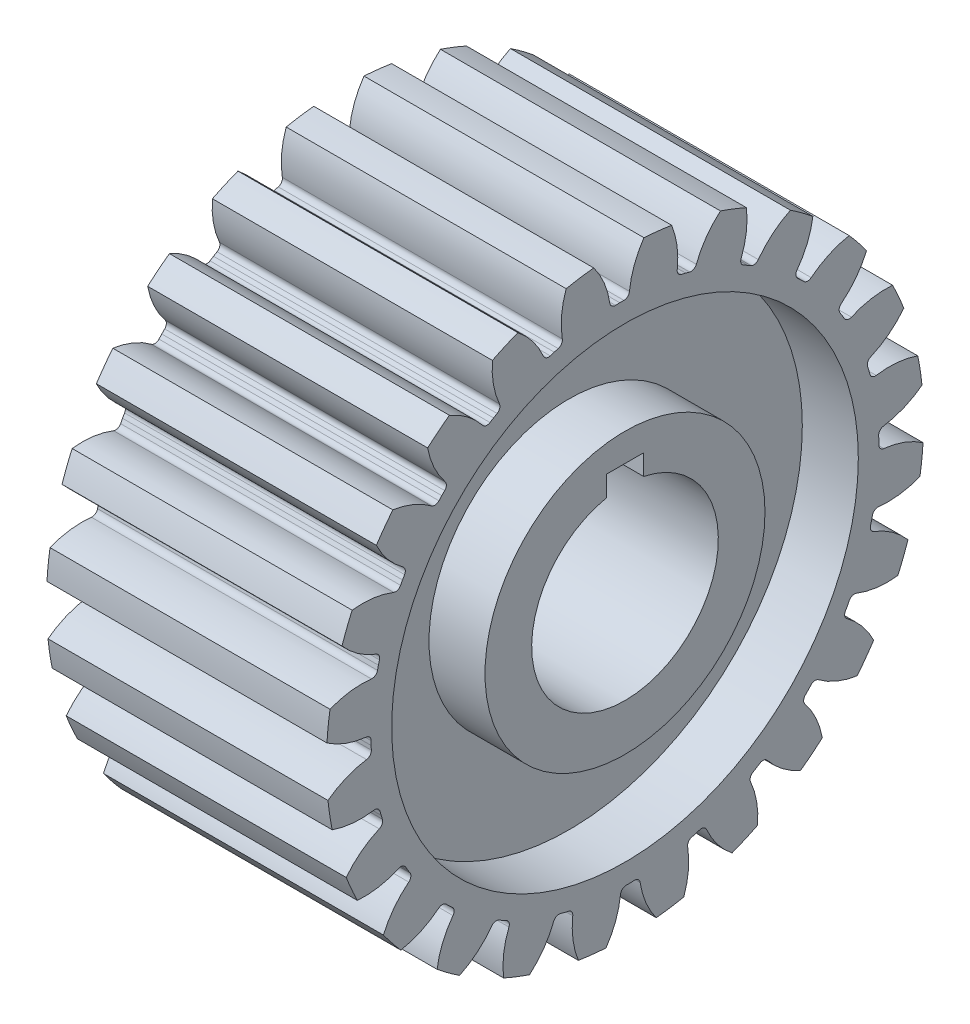
from build123d import *

# Parameters (mm, degrees)
SKETCH1_R           = 16
BOSS_EXTRUDE1_DEPTH = 7.5
CUT_EXTRUDE1_DEPTH  = 28.147743921
SKETCH3_R           = 12.5
SKETCH3_R_2         = 7.5
CUT_EXTRUDE3_DEPTH  = 3
CUT_EXTRUDE4_DEPTH  = 28.147743921
CIRPATTERN1_START   = -7.5
CIRPATTERN1_DEPTH   = 15


# Read off the part's stored shape, not the designer's step: CirPattern1
with BuildPart() as part:
    # Sketch1 → Boss-Extrude1 (new, symmetric)
    with BuildSketch(Plane(origin=(0, 0, 0), x_dir=(0, 0, -1), z_dir=(1, 0, 0))):
        Circle(SKETCH1_R)
    extrude(amount=BOSS_EXTRUDE1_DEPTH, both=True)

    # Sketch2 → Cut-Extrude1 (cut, through all)
    with BuildSketch(Plane(origin=(7.5, 0, 0), x_dir=(0, 0, -1), z_dir=(1, 0, 0))):
        with BuildLine():
            Line((-1, 6), (1, 6))
            Line((1, 6), (1, 4.898979486))
            ThreePointArc((1, 4.898979486), (0, -5), (-1, 4.898979486))
            Line((-1, 4.898979486), (-1, 6))
        make_face()
    extrude(amount=-CUT_EXTRUDE1_DEPTH, mode=Mode.SUBTRACT)

    # Sketch3 → Cut-Extrude3 (cut)
    with BuildSketch(Plane(origin=(7.5, 0, 0), x_dir=(0, 0, -1), z_dir=(1, 0, 0))):
        Circle(SKETCH3_R)
        Circle(SKETCH3_R_2, mode=Mode.SUBTRACT)
    cut_extrude3 = extrude(amount=-CUT_EXTRUDE3_DEPTH, mode=Mode.SUBTRACT)

    # Mirror1: Cut-Extrude3 across plane
    add(cut_extrude3.mirror(Plane(origin=(0, 0, 0), x_dir=(0, 0, 1), z_dir=(1, 0, 0))), mode=Mode.SUBTRACT)

    # Sketch4 → Cut-Extrude4 (cut, through all)
    with BuildSketch(Plane(origin=(7.5, 0, 0), x_dir=(0, 0, -1), z_dir=(1, 0, 0))):
        with BuildLine():
            Line((-0.281405801, 13.6), (-0.059056518, 13.6))
            ThreePointArc((-0.059056518, 13.6), (0.141499156, 13.676891458), (0.239248043, 13.868150522))
            ThreePointArc((0.239248043, 13.868150522), (0.735573834, 15.502749178), (1.798594199, 16.84))
            ThreePointArc((1.798594199, 16.84), (-0.35018508, 16.924018907), (-2.493649696, 16.751186593))
            ThreePointArc((-2.493649696, 16.751186593), (-1.376223147, 15.459052713), (-0.812706186, 13.846383903))
            ThreePointArc((-0.812706186, 13.846383903), (-0.707129438, 13.659331972), (-0.50356477, 13.590802412))
            Line((-0.50356477, 13.590802412), (-0.281405801, 13.6))
        make_face()
    extrude(amount=-CUT_EXTRUDE4_DEPTH, mode=Mode.SUBTRACT)

    # CirPattern1 outline → CirPattern1 (cut)
    with BuildSketch(Plane.YZ.offset(CIRPATTERN1_START)):
        with BuildLine():
            ThreePointArc((15.686592918, 3.151317601), (15.365838094, 4.459934939), (14.936120091, 5.736925712))
            ThreePointArc((14.936120091, 5.736925712), (14.135444289, 4.942400192), (13.164235974, 4.368721754))
            ThreePointArc((13.164235974, 4.368721754), (13.010882955, 4.218329845), (12.997374896, 4.003964719))
            Line((12.997374896, 4.003964719), (13.063758057, 3.791756144))
            Line((13.063758057, 3.791756144), (13.121306286, 3.576983229))
            ThreePointArc((13.121306286, 3.576983229), (13.247485359, 3.403162298), (13.457526702, 3.358245612))
            ThreePointArc((13.457526702, 3.358245612), (14.584955531, 3.393696665), (15.686592918, 3.151317601))
        make_face()
        with BuildLine():
            ThreePointArc((14.336464214, 7.103928057), (13.687943756, 8.284937884), (12.942358506, 9.407197048))
            ThreePointArc((12.942358506, 9.407197048), (12.374603407, 8.432514182), (11.584967118, 7.627016154))
            ThreePointArc((11.584967118, 7.627016154), (11.475763767, 7.442058043), (11.518197761, 7.231501089))
            Line((11.518197761, 7.231501089), (11.637242591, 7.043704572))
            Line((11.637242591, 7.043704572), (11.748417233, 6.851144445))
            ThreePointArc((11.748417233, 6.851144445), (11.915285025, 6.715903865), (12.129794677, 6.726880378))
            ThreePointArc((12.129794677, 6.726880378), (13.209631893, 7.052923519), (14.336464214, 7.103928057))
        make_face()
        with BuildLine():
            ThreePointArc((12.009329166, 10.572417557), (11.077238671, 11.545336004), (10.066596577, 12.436383452))
            ThreePointArc((10.066596577, 12.436383452), (9.770453752, 11.347966267), (9.216201898, 10.365542008))
            ThreePointArc((9.216201898, 10.365542008), (9.158590243, 10.158622285), (9.254074483, 9.966222611))
            Line((9.254074483, 9.966222611), (9.417668274, 9.815636174))
            Line((9.417668274, 9.815636174), (9.57489296, 9.658411488))
            ThreePointArc((9.57489296, 9.658411488), (9.771077708, 9.570967683), (9.97543719, 9.637089363))
            ThreePointArc((9.97543719, 9.637089363), (10.934093671, 10.23150529), (12.009329166, 10.572417557))
        make_face()
        with BuildLine():
            ThreePointArc((8.863778181, 13.320414272), (7.711638076, 14.018938555), (6.504812727, 14.618050876))
            ThreePointArc((6.504812727, 14.618050876), (6.500463821, 13.490073203), (6.219367749, 12.397673303))
            ThreePointArc((6.219367749, 12.397673303), (6.217273929, 12.182893206), (6.359301322, 12.021762532))
            Line((6.359301322, 12.021762532), (6.556295428, 11.918648392))
            Line((6.556295428, 11.918648392), (6.748855555, 11.80747375))
            ThreePointArc((6.748855555, 11.80747375), (6.960987592, 11.773785869), (7.141270144, 11.890546634))
            ThreePointArc((7.141270144, 11.890546634), (7.913415034, 12.712826885), (8.863778181, 13.320414272))
        make_face()
        with BuildLine():
            ThreePointArc((5.114175361, 15.160646767), (3.82050209, 15.537173611), (2.499736639, 15.80352229))
            ThreePointArc((2.499736639, 15.80352229), (2.787478023, 14.712853944), (2.798693966, 13.584923651))
            ThreePointArc((2.798693966, 13.584923651), (2.852260671, 13.376920087), (3.031152285, 13.258039202))
            Line((3.031152285, 13.258039202), (3.248121883, 13.209424418))
            Line((3.248121883, 13.209424418), (3.462894798, 13.151876189))
            ThreePointArc((3.462894798, 13.151876189), (3.676517676, 13.174240006), (3.820437339, 13.333682802))
            ThreePointArc((3.820437339, 13.333682802), (4.353450241, 14.327790336), (5.114175361, 15.160646767))
        make_face()
        with BuildLine():
            ThreePointArc((1.016049943, 15.967706239), (-0.330994798, 15.996575961), (-1.675692369, 15.912009776))
            ThreePointArc((-1.675692369, 15.912009776), (-1.115469796, 14.932978003), (-0.812706186, 13.846383903))
            ThreePointArc((-0.812706186, 13.846383903), (-0.707129438, 13.659331972), (-0.50356477, 13.590802412))
            Line((-0.50356477, 13.590802412), (-0.281405801, 13.6))
            Line((-0.281405801, 13.6), (-0.059056518, 13.6))
            ThreePointArc((-0.059056518, 13.6), (0.141499156, 13.676891458), (0.239248043, 13.868150522))
            ThreePointArc((0.239248043, 13.868150522), (0.496805008, 14.966338553), (1.016049943, 15.967706239))
        make_face()
        with BuildLine():
            ThreePointArc((-3.151317601, 15.686592919), (-4.45993494, 15.365838095), (-5.736925712, 14.936120092))
            ThreePointArc((-5.736925712, 14.936120092), (-4.942400192, 14.135444289), (-4.368721754, 13.164235974))
            ThreePointArc((-4.368721754, 13.164235974), (-4.218329845, 13.010882955), (-4.003964719, 12.997374896))
            Line((-4.003964719, 12.997374896), (-3.791756144, 13.063758057))
            Line((-3.791756144, 13.063758057), (-3.576983229, 13.121306286))
            ThreePointArc((-3.576983229, 13.121306286), (-3.403162298, 13.247485359), (-3.358245612, 13.457526702))
            ThreePointArc((-3.358245612, 13.457526702), (-3.393696665, 14.584955531), (-3.151317601, 15.686592919))
        make_face()
        with BuildLine():
            ThreePointArc((-7.103928057, 14.336464215), (-8.284937884, 13.687943756), (-9.407197049, 12.942358507))
            ThreePointArc((-9.407197049, 12.942358507), (-8.432514182, 12.374603407), (-7.627016154, 11.584967118))
            ThreePointArc((-7.627016154, 11.584967118), (-7.442058043, 11.475763767), (-7.231501089, 11.518197761))
            Line((-7.231501089, 11.518197761), (-7.043704572, 11.637242591))
            Line((-7.043704572, 11.637242591), (-6.851144445, 11.748417233))
            ThreePointArc((-6.851144445, 11.748417233), (-6.715903865, 11.915285025), (-6.726880378, 12.129794677))
            ThreePointArc((-6.726880378, 12.129794677), (-7.052923519, 13.209631893), (-7.103928057, 14.336464215))
        make_face()
        with BuildLine():
            ThreePointArc((-10.572417557, 12.009329166), (-11.545336004, 11.077238671), (-12.436383452, 10.066596577))
            ThreePointArc((-12.436383452, 10.066596577), (-11.347966267, 9.770453752), (-10.365542008, 9.216201898))
            ThreePointArc((-10.365542008, 9.216201898), (-10.158622285, 9.158590243), (-9.966222611, 9.254074483))
            Line((-9.966222611, 9.254074483), (-9.815636174, 9.417668274))
            Line((-9.815636174, 9.417668274), (-9.658411488, 9.57489296))
            ThreePointArc((-9.658411488, 9.57489296), (-9.570967683, 9.771077708), (-9.637089363, 9.97543719))
            ThreePointArc((-9.637089363, 9.97543719), (-10.23150529, 10.934093671), (-10.572417557, 12.009329166))
        make_face()
        with BuildLine():
            ThreePointArc((-13.320414272, 8.863778181), (-14.018938555, 7.711638076), (-14.618050875, 6.504812727))
            ThreePointArc((-14.618050875, 6.504812727), (-13.490073203, 6.500463821), (-12.397673303, 6.219367749))
            ThreePointArc((-12.397673303, 6.219367749), (-12.182893206, 6.217273929), (-12.021762532, 6.359301322))
            Line((-12.021762532, 6.359301322), (-11.918648392, 6.556295428))
            Line((-11.918648392, 6.556295428), (-11.80747375, 6.748855555))
            ThreePointArc((-11.80747375, 6.748855555), (-11.773785869, 6.960987592), (-11.890546634, 7.141270144))
            ThreePointArc((-11.890546634, 7.141270144), (-12.712826885, 7.913415034), (-13.320414272, 8.863778181))
        make_face()
        with BuildLine():
            ThreePointArc((-15.160646767, 5.114175361), (-15.53717361, 3.82050209), (-15.803522289, 2.499736639))
            ThreePointArc((-15.803522289, 2.499736639), (-14.712853944, 2.787478023), (-13.584923651, 2.798693966))
            ThreePointArc((-13.584923651, 2.798693966), (-13.376920087, 2.852260671), (-13.258039202, 3.031152285))
            Line((-13.258039202, 3.031152285), (-13.209424418, 3.248121883))
            Line((-13.209424418, 3.248121883), (-13.151876189, 3.462894798))
            ThreePointArc((-13.151876189, 3.462894798), (-13.174240006, 3.676517676), (-13.333682802, 3.820437339))
            ThreePointArc((-13.333682802, 3.820437339), (-14.327790336, 4.353450241), (-15.160646767, 5.114175361))
        make_face()
        with BuildLine():
            ThreePointArc((-15.967706238, 1.016049943), (-15.99657596, -0.330994798), (-15.912009775, -1.675692369))
            ThreePointArc((-15.912009775, -1.675692369), (-14.932978003, -1.115469796), (-13.846383903, -0.812706186))
            ThreePointArc((-13.846383903, -0.812706186), (-13.659331972, -0.707129438), (-13.590802412, -0.50356477))
            Line((-13.590802412, -0.50356477), (-13.6, -0.281405801))
            Line((-13.6, -0.281405801), (-13.6, -0.059056518))
            ThreePointArc((-13.6, -0.059056518), (-13.676891458, 0.141499156), (-13.868150522, 0.239248043))
            ThreePointArc((-13.868150522, 0.239248043), (-14.966338553, 0.496805008), (-15.967706238, 1.016049943))
        make_face()
        with BuildLine():
            ThreePointArc((-15.686592918, -3.151317601), (-15.365838094, -4.459934939), (-14.936120091, -5.736925712))
            ThreePointArc((-14.936120091, -5.736925712), (-14.135444289, -4.942400192), (-13.164235974, -4.368721754))
            ThreePointArc((-13.164235974, -4.368721754), (-13.010882955, -4.218329845), (-12.997374896, -4.003964719))
            Line((-12.997374896, -4.003964719), (-13.063758057, -3.791756144))
            Line((-13.063758057, -3.791756144), (-13.121306286, -3.576983229))
            ThreePointArc((-13.121306286, -3.576983229), (-13.247485359, -3.403162298), (-13.457526702, -3.358245612))
            ThreePointArc((-13.457526702, -3.358245612), (-14.584955531, -3.393696665), (-15.686592918, -3.151317601))
        make_face()
        with BuildLine():
            ThreePointArc((-14.336464214, -7.103928057), (-13.687943755, -8.284937884), (-12.942358506, -9.407197048))
            ThreePointArc((-12.942358506, -9.407197048), (-12.374603407, -8.432514182), (-11.584967118, -7.627016154))
            ThreePointArc((-11.584967118, -7.627016154), (-11.475763767, -7.442058043), (-11.518197761, -7.231501089))
            Line((-11.518197761, -7.231501089), (-11.637242591, -7.043704572))
            Line((-11.637242591, -7.043704572), (-11.748417233, -6.851144445))
            ThreePointArc((-11.748417233, -6.851144445), (-11.915285025, -6.715903865), (-12.129794677, -6.726880378))
            ThreePointArc((-12.129794677, -6.726880378), (-13.209631893, -7.052923519), (-14.336464214, -7.103928057))
        make_face()
        with BuildLine():
            ThreePointArc((-12.009329165, -10.572417556), (-11.07723867, -11.545336003), (-10.066596576, -12.436383451))
            ThreePointArc((-10.066596576, -12.436383451), (-9.770453752, -11.347966267), (-9.216201898, -10.365542008))
            ThreePointArc((-9.216201898, -10.365542008), (-9.158590243, -10.158622285), (-9.254074483, -9.966222611))
            Line((-9.254074483, -9.966222611), (-9.417668274, -9.815636174))
            Line((-9.417668274, -9.815636174), (-9.57489296, -9.658411488))
            ThreePointArc((-9.57489296, -9.658411488), (-9.771077708, -9.570967683), (-9.97543719, -9.637089363))
            ThreePointArc((-9.97543719, -9.637089363), (-10.934093671, -10.23150529), (-12.009329165, -10.572417556))
        make_face()
        with BuildLine():
            ThreePointArc((-8.863778181, -13.32041427), (-7.711638076, -14.018938553), (-6.504812727, -14.618050874))
            ThreePointArc((-6.504812727, -14.618050874), (-6.500463821, -13.490073203), (-6.219367749, -12.397673303))
            ThreePointArc((-6.219367749, -12.397673303), (-6.217273929, -12.182893206), (-6.359301322, -12.021762532))
            Line((-6.359301322, -12.021762532), (-6.556295428, -11.918648392))
            Line((-6.556295428, -11.918648392), (-6.748855555, -11.80747375))
            ThreePointArc((-6.748855555, -11.80747375), (-6.960987592, -11.773785869), (-7.141270144, -11.890546634))
            ThreePointArc((-7.141270144, -11.890546634), (-7.913415034, -12.712826885), (-8.863778181, -13.32041427))
        make_face()
        with BuildLine():
            ThreePointArc((-5.114175361, -15.160646765), (-3.82050209, -15.537173609), (-2.499736639, -15.803522288))
            ThreePointArc((-2.499736639, -15.803522288), (-2.787478023, -14.712853944), (-2.798693966, -13.584923651))
            ThreePointArc((-2.798693966, -13.584923651), (-2.852260671, -13.376920087), (-3.031152285, -13.258039202))
            Line((-3.031152285, -13.258039202), (-3.248121883, -13.209424418))
            Line((-3.248121883, -13.209424418), (-3.462894798, -13.151876189))
            ThreePointArc((-3.462894798, -13.151876189), (-3.676517676, -13.174240006), (-3.820437339, -13.333682802))
            ThreePointArc((-3.820437339, -13.333682802), (-4.353450241, -14.327790336), (-5.114175361, -15.160646765))
        make_face()
        with BuildLine():
            ThreePointArc((-1.016049943, -15.967706237), (0.330994798, -15.996575959), (1.675692369, -15.912009774))
            ThreePointArc((1.675692369, -15.912009774), (1.115469796, -14.932978003), (0.812706186, -13.846383903))
            ThreePointArc((0.812706186, -13.846383903), (0.707129438, -13.659331972), (0.50356477, -13.590802412))
            Line((0.50356477, -13.590802412), (0.281405801, -13.6))
            Line((0.281405801, -13.6), (0.059056518, -13.6))
            ThreePointArc((0.059056518, -13.6), (-0.141499156, -13.676891458), (-0.239248043, -13.868150522))
            ThreePointArc((-0.239248043, -13.868150522), (-0.496805008, -14.966338553), (-1.016049943, -15.967706237))
        make_face()
        with BuildLine():
            ThreePointArc((3.151317601, -15.686592917), (4.459934939, -15.365838093), (5.736925712, -14.93612009))
            ThreePointArc((5.736925712, -14.93612009), (4.942400192, -14.135444289), (4.368721754, -13.164235974))
            ThreePointArc((4.368721754, -13.164235974), (4.218329845, -13.010882955), (4.003964719, -12.997374896))
            Line((4.003964719, -12.997374896), (3.791756144, -13.063758057))
            Line((3.791756144, -13.063758057), (3.576983229, -13.121306286))
            ThreePointArc((3.576983229, -13.121306286), (3.403162298, -13.247485359), (3.358245612, -13.457526702))
            ThreePointArc((3.358245612, -13.457526702), (3.393696665, -14.584955531), (3.151317601, -15.686592917))
        make_face()
        with BuildLine():
            ThreePointArc((7.103928057, -14.336464213), (8.284937883, -13.687943755), (9.407197047, -12.942358505))
            ThreePointArc((9.407197047, -12.942358505), (8.432514182, -12.374603407), (7.627016154, -11.584967118))
            ThreePointArc((7.627016154, -11.584967118), (7.442058043, -11.475763767), (7.231501089, -11.518197761))
            Line((7.231501089, -11.518197761), (7.043704572, -11.637242591))
            Line((7.043704572, -11.637242591), (6.851144445, -11.748417233))
            ThreePointArc((6.851144445, -11.748417233), (6.715903865, -11.915285025), (6.726880378, -12.129794677))
            ThreePointArc((6.726880378, -12.129794677), (7.052923519, -13.209631893), (7.103928057, -14.336464213))
        make_face()
        with BuildLine():
            ThreePointArc((10.572417556, -12.009329165), (11.545336003, -11.07723867), (12.436383451, -10.066596576))
            ThreePointArc((12.436383451, -10.066596576), (11.347966267, -9.770453752), (10.365542008, -9.216201898))
            ThreePointArc((10.365542008, -9.216201898), (10.158622285, -9.158590243), (9.966222611, -9.254074483))
            Line((9.966222611, -9.254074483), (9.815636174, -9.417668274))
            Line((9.815636174, -9.417668274), (9.658411488, -9.57489296))
            ThreePointArc((9.658411488, -9.57489296), (9.570967683, -9.771077708), (9.637089363, -9.97543719))
            ThreePointArc((9.637089363, -9.97543719), (10.23150529, -10.934093671), (10.572417556, -12.009329165))
        make_face()
        with BuildLine():
            ThreePointArc((13.320414271, -8.863778181), (14.018938554, -7.711638076), (14.618050874, -6.504812727))
            ThreePointArc((14.618050874, -6.504812727), (13.490073203, -6.500463821), (12.397673303, -6.219367749))
            ThreePointArc((12.397673303, -6.219367749), (12.182893206, -6.217273929), (12.021762532, -6.359301322))
            Line((12.021762532, -6.359301322), (11.918648392, -6.556295428))
            Line((11.918648392, -6.556295428), (11.80747375, -6.748855555))
            ThreePointArc((11.80747375, -6.748855555), (11.773785869, -6.960987592), (11.890546634, -7.141270144))
            ThreePointArc((11.890546634, -7.141270144), (12.712826885, -7.913415034), (13.320414271, -8.863778181))
        make_face()
        with BuildLine():
            ThreePointArc((15.803522289, -2.499736639), (14.712853944, -2.787478023), (13.584923651, -2.798693966))
            ThreePointArc((13.584923651, -2.798693966), (13.376920087, -2.852260671), (13.258039202, -3.031152285))
            Line((13.258039202, -3.031152285), (13.209424418, -3.248121883))
            Line((13.209424418, -3.248121883), (13.151876189, -3.462894798))
            ThreePointArc((13.151876189, -3.462894798), (13.174240006, -3.676517676), (13.333682802, -3.820437339))
            ThreePointArc((13.333682802, -3.820437339), (14.327790336, -4.353450241), (15.160646766, -5.114175361))
            ThreePointArc((15.160646766, -5.114175361), (15.537173609, -3.82050209), (15.803522289, -2.499736639))
        make_face()
    extrude(amount=CIRPATTERN1_DEPTH, mode=Mode.SUBTRACT)


solid = part.part
